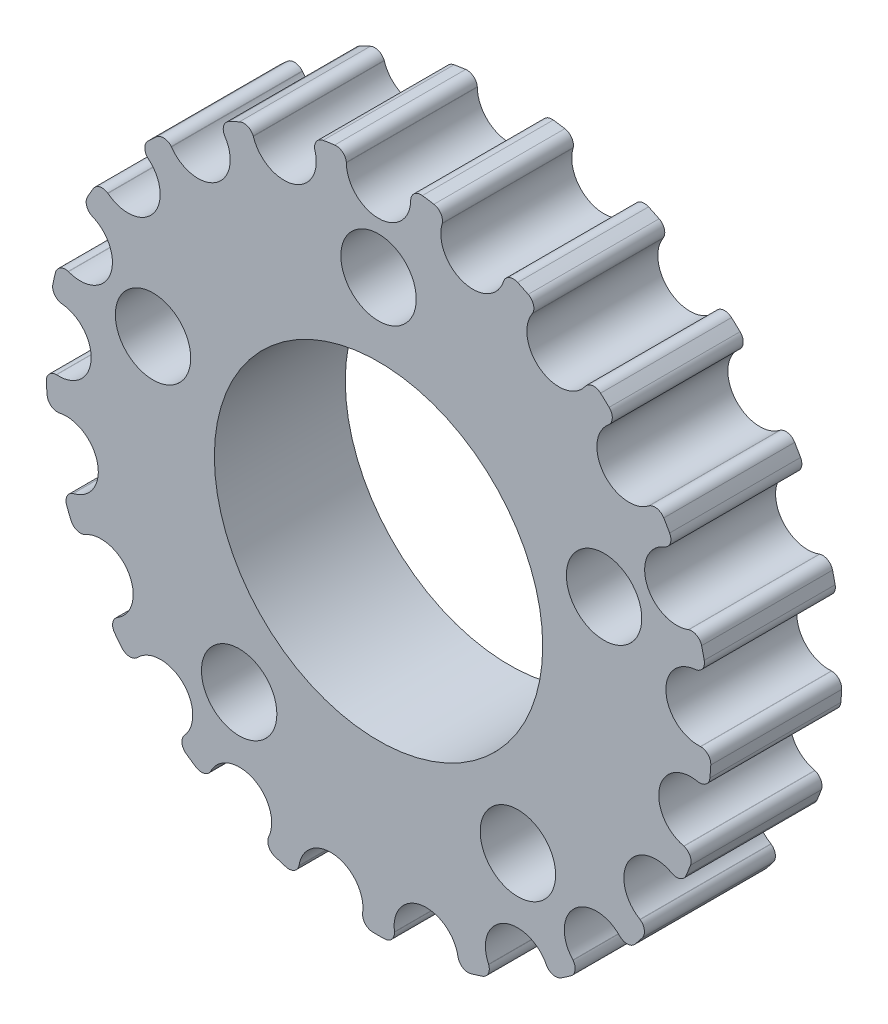
from build123d import *

# Parameters (mm, degrees)
SKETCH2_R                = 16.139769025
BOSS_EXTRUDE1_DEPTH      = 6.35
CUT_EXTRUDE1_DEPTH       = 24.691913986
FILLET1_R                = 0.5
CIRPATTERN1_COUNT        = 21
FILLET1_OF_CIRPATTERN1_R = 0.5
SKETCH4_R                = 7.9629
CUT_EXTRUDE2_DEPTH       = 24.674479536
F_6_CLEARANCE_HOLE1_D    = 3.6576
CIRPATTERN2_COUNT        = 5


with BuildPart() as part:
    # Sketch2 → Boss-Extrude1 (new body)
    with BuildSketch(Plane.XY):
        Circle(SKETCH2_R)
    extrude(amount=BOSS_EXTRUDE1_DEPTH)

    # Sketch3 → Cut-Extrude1 (cut, through all)
    with BuildSketch(Plane(origin=(0, 0, 0), x_dir=(-1, 0, 0), z_dir=(0, 0, -1))):
        with BuildLine():
            Line((-1.612129665, 16.059052964), (-1.56, 15.539769025))
            ThreePointArc((-1.56, 15.539769025), (0, 13.979769025), (1.56, 15.539769025))
            Line((1.56, 15.539769025), (1.612129665, 16.059052964))
            ThreePointArc((1.612129665, 16.059052964), (0, 16.139769025), (-1.612129665, 16.059052964))
        make_face()
    cut_extrude1 = extrude(amount=-CUT_EXTRUDE1_DEPTH, mode=Mode.SUBTRACT)

    # Fillet1
    fillet1_edges = [part.edges().sort_by_distance(p)[0] for p in [
        (-1.612129665, 16.059052964, 3.175),
        (1.612129665, 16.059052964, 3.175),
    ]]
    fillet(fillet1_edges, radius=FILLET1_R)

    # CirPattern1: Cut-Extrude1 ×21 about axis
    cirpattern1_axis = Axis((0, 0, 0), (0, 0, 1))
    for i in range(1, CIRPATTERN1_COUNT):
        add(cut_extrude1.rotate(cirpattern1_axis, i * 360 / CIRPATTERN1_COUNT), mode=Mode.SUBTRACT)

    # Fillet1 of CirPattern1
    fillet1_of_cirpattern1_edges = [part.edges().sort_by_distance(p)[0] for p in [
        (-6.273996224, 14.870410739, 3.175),
        (-3.192981691, 15.82077786, 3.175),
        (-10.378390686, 12.360467262, 3.175),
        (-7.71438261, 14.176757214, 3.175),
        (-13.560619591, 8.752242025, 3.175),
        (-11.550326781, 11.273069476, 3.175),
        (-15.537927936, 4.366341676, 3.175),
        (-14.35997373, 7.367720044, 3.175),
        (-16.134623196, -0.407527292, 3.175),
        (-15.893673995, 2.807716354, 3.175),
        (-15.29768638, -5.145185672, 3.175),
        (-16.015151577, -2.001765256, 3.175),
        (-13.101482996, -9.425671726, 3.175),
        (-14.71361266, -6.633381239, 3.175),
        (-9.741155353, -12.868645483, 3.175),
        (-12.104704689, -10.675592188, 3.175),
        (-5.515283308, -15.168183616, 3.175),
        (-8.420240586, -13.769229922, 3.175),
        (-0.799354138, -16.11996207, 3.175),
        (-3.987601155, -15.639411153, 3.175),
        (3.987601155, -15.639411153, 3.175),
        (0.799354138, -16.11996207, 3.175),
        (8.420240586, -13.769229922, 3.175),
        (5.515283308, -15.168183616, 3.175),
        (12.104704689, -10.675592188, 3.175),
        (9.741155353, -12.868645483, 3.175),
        (14.71361266, -6.633381239, 3.175),
        (13.101482996, -9.425671726, 3.175),
        (16.015151577, -2.001765256, 3.175),
        (15.29768638, -5.145185672, 3.175),
        (15.893673995, 2.807716354, 3.175),
        (16.134623196, -0.407527292, 3.175),
        (14.35997373, 7.367720044, 3.175),
        (15.537927936, 4.366341676, 3.175),
        (11.550326781, 11.273069476, 3.175),
        (13.560619591, 8.752242025, 3.175),
        (7.71438261, 14.176757214, 3.175),
        (10.378390686, 12.360467262, 3.175),
        (3.192981691, 15.82077786, 3.175),
        (6.273996224, 14.870410739, 3.175),
    ]]
    fillet(fillet1_of_cirpattern1_edges, radius=FILLET1_OF_CIRPATTERN1_R)

    # Sketch4 → Cut-Extrude2 (cut, through all)
    with BuildSketch(Plane.XY.offset(6.35)):
        Circle(SKETCH4_R)
    extrude(amount=-CUT_EXTRUDE2_DEPTH, mode=Mode.SUBTRACT)

    # #6 Clearance Hole1 (through all)
    with Locations(Plane.XY.offset(6.35)):
        with Locations((0, 11.5)):
            f_6_clearance_hole1 = Hole(F_6_CLEARANCE_HOLE1_D / 2)

    # CirPattern2: #6 Clearance Hole1 ×5 about axis
    cirpattern2_axis = Axis((0, 0, 6.35), (0, 0, 1))
    for i in range(1, CIRPATTERN2_COUNT):
        add(f_6_clearance_hole1.rotate(cirpattern2_axis, i * 360 / CIRPATTERN2_COUNT), mode=Mode.SUBTRACT)


solid = part.part
